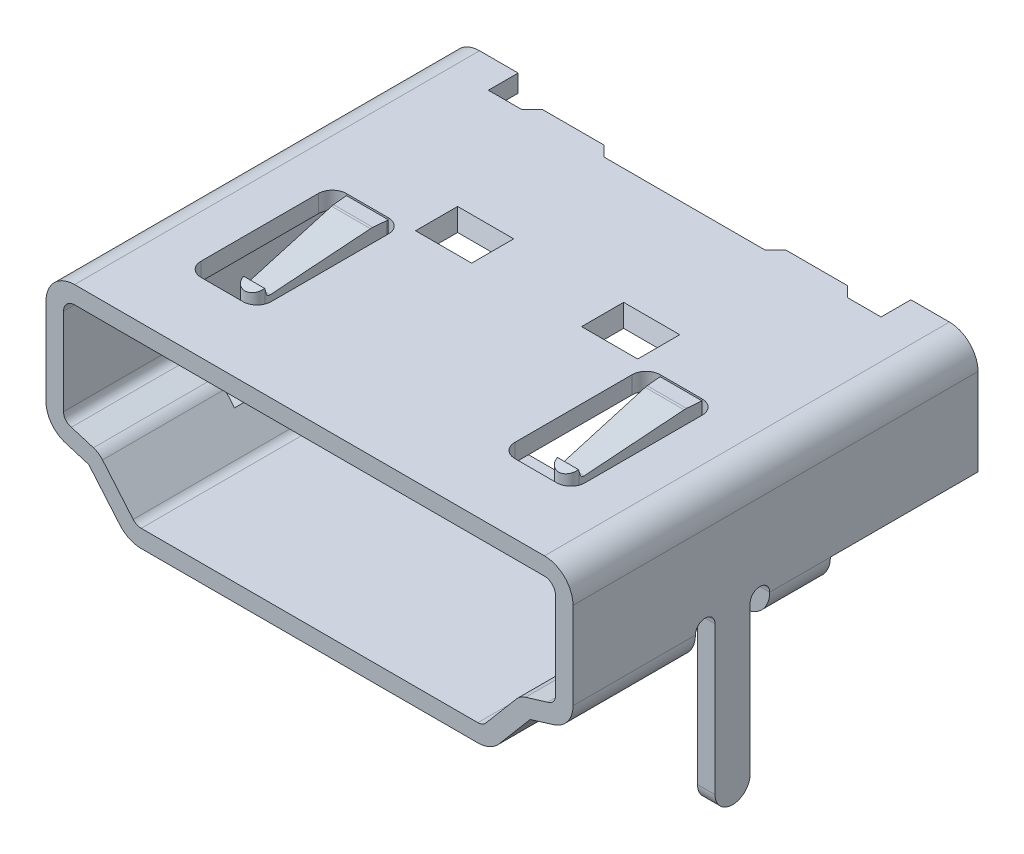
from build123d import *

# Parameters (mm, degrees)
BOSS_EXTRUDE1_DEPTH          = 11.55
CUT_EXTRUDE1_DEPTH           = 1.55
SKETCH4_W                    = 1.6
SKETCH4_H                    = 1.2
CUT_EXTRUDE2_DEPTH           = 1.55
CUT_EXTRUDE2_DRAFT           = -16
CUT_EXTRUDE2_PROFILE_2_DEPTH = 1.55
CUT_EXTRUDE2_PROFILE_2_DRAFT = -16
SKETCH5_W                    = 8.280650406
SKETCH5_H                    = 2.274542755
CUT_EXTRUDE3_DEPTH           = 20.322884811
CUT_EXTRUDE4_DEPTH           = 20.322884811
SKETCH7_W                    = 1
SKETCH7_H                    = 0.960522576
CUT_EXTRUDE5_DEPTH           = 20.322884811
SKETCH8_W                    = 0.5
SKETCH8_H                    = 1
BOSS_EXTRUDE2_DEPTH          = 4.72
FILLET1_RADIUS               = 0.5
FILLET1_LENGTH               = 0.5
FILLET1_OF_MIRROR1_2_RADIUS  = 0.5
FILLET1_OF_MIRROR1_2_LENGTH  = 0.5
CUT_EXTRUDE6_DEPTH           = 0.72
THICKEN1_START               = -5.069732995
THICKEN1_DEPTH               = 1.19
CUT_EXTRUDE7_DEPTH           = 1.19


# Read off the part's stored shape, not the designer's step: Thicken1
with BuildPart() as part:
    # Sketch2 → Boss-Extrude1 (new body)
    # profile 1 of 2: a face of its own
    with BuildSketch(Plane.XY):
        with BuildLine():
            Line((-6.7, 3.75320256), (6.7, 3.75320256))
            ThreePointArc((6.7, 3.75320256), (7.276103226, 3.514572791), (7.514732995, 2.938469565))
            Line((7.514732995, 2.938469565), (7.514732995, 0.458469565))
            ThreePointArc((7.514732995, 0.458469565), (7.348259409, -0.022963248), (6.919955693, -0.298729334))
            Line((6.919955693, -0.298729334), (6.308219645, -0.486088329))
            ThreePointArc((6.308219645, -0.486088329), (6.294961075, -0.49232974), (6.283997368, -0.502053011))
            Line((6.283997368, -0.502053011), (5.410870468, -1.533379231))
            ThreePointArc((5.410870468, -1.533379231), (5.13717933, -1.74196217), (4.801141776, -1.81607319))
            Line((4.801141776, -1.81607319), (-4.801141776, -1.81607319))
            ThreePointArc((-4.801141776, -1.81607319), (-5.13717933, -1.74196217), (-5.410870468, -1.533379231))
            Line((-5.410870468, -1.533379231), (-6.283997368, -0.502053011))
            ThreePointArc((-6.283997368, -0.502053011), (-6.294961075, -0.49232974), (-6.308219645, -0.486088329))
            Line((-6.308219645, -0.486088329), (-6.919955693, -0.298729334))
            ThreePointArc((-6.919955693, -0.298729334), (-7.348259409, -0.022963248), (-7.514732995, 0.458469565))
            Line((-7.514732995, 0.458469565), (-7.514732995, 2.938469565))
            ThreePointArc((-7.514732995, 2.938469565), (-7.276103226, 3.514572791), (-6.7, 3.75320256))
        make_face()
        with BuildLine():
            ThreePointArc((-6.7, 3.50320256), (-7.099326531, 3.337796096), (-7.264732995, 2.938469565))
            Line((-7.264732995, 2.938469565), (-7.264732995, 0.458469565))
            ThreePointArc((-7.264732995, 0.458469565), (-7.149624286, 0.12889174), (-6.854357158, -0.057357774))
            Line((-6.854357158, -0.057357774), (-6.235007902, -0.247048498))
            ThreePointArc((-6.235007902, -0.247048498), (-6.157382735, -0.283590188), (-6.093193339, -0.340517187))
            Line((-6.093193339, -0.340517187), (-5.220066439, -1.371843407))
            ThreePointArc((-5.220066439, -1.371843407), (-5.0320222, -1.51515393), (-4.801141776, -1.56607319))
            Line((-4.801141776, -1.56607319), (4.801141776, -1.56607319))
            ThreePointArc((4.801141776, -1.56607319), (5.0320222, -1.51515393), (5.220066439, -1.371843407))
            Line((5.220066439, -1.371843407), (6.093193339, -0.340517187))
            ThreePointArc((6.093193339, -0.340517187), (6.157382735, -0.283590188), (6.235007902, -0.247048498))
            Line((6.235007902, -0.247048498), (6.854357158, -0.057357774))
            ThreePointArc((6.854357158, -0.057357774), (7.149624286, 0.12889174), (7.264732995, 0.458469565))
            Line((7.264732995, 0.458469565), (7.264732995, 2.938469565))
            ThreePointArc((7.264732995, 2.938469565), (7.099326531, 3.337796096), (6.7, 3.50320256))
            Line((6.7, 3.50320256), (-6.7, 3.50320256))
        make_face(mode=Mode.SUBTRACT)
    # profile 2 of 2: a face of its own
    with BuildSketch(Plane.XY):
        with BuildLine():
            Line((-6.7, 3.50320256), (6.7, 3.50320256))
            ThreePointArc((6.7, 3.50320256), (7.099326531, 3.337796096), (7.264732995, 2.938469565))
            Line((7.264732995, 2.938469565), (7.264732995, 0.458469565))
            ThreePointArc((7.264732995, 0.458469565), (7.149624286, 0.12889174), (6.854357158, -0.057357774))
            Line((6.854357158, -0.057357774), (6.235007902, -0.247048498))
            ThreePointArc((6.235007902, -0.247048498), (6.157382735, -0.283590188), (6.093193339, -0.340517187))
            Line((6.093193339, -0.340517187), (5.220066439, -1.371843407))
            ThreePointArc((5.220066439, -1.371843407), (5.0320222, -1.51515393), (4.801141776, -1.56607319))
            Line((4.801141776, -1.56607319), (-4.801141776, -1.56607319))
            ThreePointArc((-4.801141776, -1.56607319), (-5.0320222, -1.51515393), (-5.220066439, -1.371843407))
            Line((-5.220066439, -1.371843407), (-6.093193339, -0.340517187))
            ThreePointArc((-6.093193339, -0.340517187), (-6.157382735, -0.283590188), (-6.235007902, -0.247048498))
            Line((-6.235007902, -0.247048498), (-6.854357158, -0.057357774))
            ThreePointArc((-6.854357158, -0.057357774), (-7.149624286, 0.12889174), (-7.264732995, 0.458469565))
            Line((-7.264732995, 0.458469565), (-7.264732995, 2.938469565))
            ThreePointArc((-7.264732995, 2.938469565), (-7.099326531, 3.337796096), (-6.7, 3.50320256))
        make_face()
        with BuildLine():
            ThreePointArc((-6.7, 3.25320256), (-6.922549835, 3.1610194), (-7.014732995, 2.938469565))
            Line((-7.014732995, 2.938469565), (-7.014732995, 0.458469565))
            ThreePointArc((-7.014732995, 0.458469565), (-6.951656403, 0.281649019), (-6.790909083, 0.184672417))
            Line((-6.790909083, 0.184672417), (-6.161796159, -0.008008667))
            ThreePointArc((-6.161796159, -0.008008667), (-6.019804394, -0.074850637), (-5.902389309, -0.178981364))
            Line((-5.902389309, -0.178981364), (-5.029262409, -1.210307583))
            ThreePointArc((-5.029262409, -1.210307583), (-4.92686507, -1.288345689), (-4.801141776, -1.31607319))
            Line((-4.801141776, -1.31607319), (4.801141776, -1.31607319))
            ThreePointArc((4.801141776, -1.31607319), (4.92686507, -1.288345689), (5.029262409, -1.210307583))
            Line((5.029262409, -1.210307583), (5.902389309, -0.178981364))
            ThreePointArc((5.902389309, -0.178981364), (6.019804394, -0.074850637), (6.161796159, -0.008008667))
            Line((6.161796159, -0.008008667), (6.790909083, 0.184672417))
            ThreePointArc((6.790909083, 0.184672417), (6.951656403, 0.281649019), (7.014732995, 0.458469565))
            Line((7.014732995, 0.458469565), (7.014732995, 2.938469565))
            ThreePointArc((7.014732995, 2.938469565), (6.922549835, 3.1610194), (6.7, 3.25320256))
            Line((6.7, 3.25320256), (-6.7, 3.25320256))
        make_face(mode=Mode.SUBTRACT)
    extrude(amount=-BOSS_EXTRUDE1_DEPTH)

    # Sketch3 → Cut-Extrude1 (cut)
    with BuildSketch(Plane(origin=(0, 3.75320256, 0), x_dir=(1, 0, 0), z_dir=(0, 1, 0))):
        Polygon((-5.6, 11.55), (-5.6, 10.7), (-4.65, 10.7), (-4.354264255, 10.995735745), (-2.594264255, 10.995735745), (-2.298528509, 10.7), (2.298528509, 10.7), (2.594264255, 10.995735745), (4.354264255, 10.995735745), (4.65, 10.7), (5.6, 10.7), (5.6, 11.55), align=None)
    extrude(amount=-CUT_EXTRUDE1_DEPTH, mode=Mode.SUBTRACT)


with BuildPart() as cut_extrude2_tool:
    # Sketch4 → Cut-Extrude2 (with draft: the straight prism first)
    with BuildSketch(Plane(origin=(0, 3.75320256, 0), x_dir=(1, 0, 0), z_dir=(0, 1, 0))):
        with Locations((-2.367658428, 6.791688741)):
            Rectangle(SKETCH4_W, SKETCH4_H)
    extrude(amount=-CUT_EXTRUDE2_DEPTH)
    # Cut-Extrude2: the draft: its side faces are tilted about the plane it starts from
    cut_extrude2_sides = [cut_extrude2_tool.faces().sort_by_distance(p)[0] for p in [
        (-3.167658428, 2.97820256, -6.791688741),
        (-2.367658428, 2.97820256, -6.191688741),
        (-1.567658428, 2.97820256, -6.791688741),
        (-2.367658428, 2.97820256, -7.391688741),
    ]]
    draft(cut_extrude2_sides, Plane(origin=(0, 3.75320256, 0), x_dir=(1, 0, 0), z_dir=(0, 1, 0)), CUT_EXTRUDE2_DRAFT)


with BuildPart() as part_1:
    add(part.part)

    # Cut-Extrude2: cut by cut_extrude2_tool
    add(cut_extrude2_tool.part, mode=Mode.SUBTRACT)


with BuildPart() as cut_extrude2_profile_2_tool:
    # Sketch4 → Cut-Extrude2 profile 2 (with draft: the straight prism first)
    with BuildSketch(Plane(origin=(0, 3.75320256, 0), x_dir=(1, 0, 0), z_dir=(0, 1, 0))):
        with Locations((2.367658428, 6.791688741)):
            Rectangle(SKETCH4_W, SKETCH4_H)
    extrude(amount=-CUT_EXTRUDE2_PROFILE_2_DEPTH)
    # Cut-Extrude2 profile 2: the draft: its side faces are tilted about the plane it starts from
    cut_extrude2_profile_2_sides = [cut_extrude2_profile_2_tool.faces().sort_by_distance(p)[0] for p in [
        (1.567658428, 2.97820256, -6.791688741),
        (2.367658428, 2.97820256, -6.191688741),
        (3.167658428, 2.97820256, -6.791688741),
        (2.367658428, 2.97820256, -7.391688741),
    ]]
    draft(cut_extrude2_profile_2_sides, Plane(origin=(0, 3.75320256, 0), x_dir=(1, 0, 0), z_dir=(0, 1, 0)), CUT_EXTRUDE2_PROFILE_2_DRAFT)


with BuildPart() as part_2:
    add(part_1.part)

    # Cut-Extrude2 profile 2: cut by cut_extrude2_profile_2_tool
    add(cut_extrude2_profile_2_tool.part, mode=Mode.SUBTRACT)

    # Sketch5 → Cut-Extrude3 (cut, through all)
    with BuildSketch(Plane(origin=(7.514732995, 0, 0), x_dir=(0, 0, -1), z_dir=(1, 0, 0))):
        with Locations((11.480325203, -0.678801812)):
            Rectangle(SKETCH5_W, SKETCH5_H)
    extrude(amount=-CUT_EXTRUDE3_DEPTH, mode=Mode.SUBTRACT)

    # Sketch6 → Cut-Extrude4 (cut, through all)
    with BuildSketch(Plane(origin=(7.514732995, 0, 0), x_dir=(0, 0, -1), z_dir=(1, 0, 0))):
        with BuildLine():
            Line((3.49, -0.502053011), (3.49, 0.458469565))
            ThreePointArc((3.49, 0.458469565), (3.77, 0.738469565), (4.05, 0.458469565))
            Line((4.05, 0.458469565), (4.05, -0.502053011))
            Line((4.05, -0.502053011), (3.49, -0.502053011))
        make_face()
        with BuildLine():
            Line((5.05, -0.502053011), (5.05, 0.458469565))
            ThreePointArc((5.05, 0.458469565), (5.33, 0.738469565), (5.61, 0.458469565))
            Line((5.61, 0.458469565), (5.61, -0.502053011))
            Line((5.61, -0.502053011), (5.05, -0.502053011))
        make_face()
    extrude(amount=-CUT_EXTRUDE4_DEPTH, mode=Mode.SUBTRACT)

    # Sketch7 → Cut-Extrude5 (cut, through all)
    with BuildSketch(Plane(origin=(7.514732995, 0, 0), x_dir=(0, 0, -1), z_dir=(1, 0, 0))):
        with Locations((4.55, -0.021791723)):
            Rectangle(SKETCH7_W, SKETCH7_H)
    extrude(amount=-CUT_EXTRUDE5_DEPTH, mode=Mode.SUBTRACT)

    # Sketch8 → Boss-Extrude2 (add)
    with BuildSketch(Plane.XZ.offset(-0.458469565)):
        with Locations((7.264732995, -4.55)):
            Rectangle(SKETCH8_W, SKETCH8_H)
    boss_extrude2 = extrude(amount=BOSS_EXTRUDE2_DEPTH)

    # Fillet1: full round fillet: the end face becomes a half cylinder, R = half its width
    fillet1_face = Plane((7.264732995, -4.261530435, -4.55), x_dir=(1, 0, 0), z_dir=(0, -1, 0))  # on the end face: x along it, z out of the body
    fillet1_slab = fillet1_face.offset(-FILLET1_RADIUS / 2) * Box(FILLET1_LENGTH, 2 * FILLET1_RADIUS, FILLET1_RADIUS, mode=Mode.PRIVATE)  # the body's end, R deep
    fillet1_round = Plane((7.264732995, -3.761530435, -4.55), x_dir=(0, -1, 0), z_dir=(1, 0, 0)) * Cylinder(FILLET1_RADIUS, FILLET1_LENGTH, mode=Mode.PRIVATE)  # its axis R under the face
    add(fillet1_slab - fillet1_round, mode=Mode.SUBTRACT)

    # Mirror1: Boss-Extrude2 across plane
    add(boss_extrude2.mirror(Plane(origin=(0, 0, 0), x_dir=(0, 0, 1), z_dir=(1, 0, 0))))

    # Fillet1 of Mirror1 2: full round fillet: the end face becomes a half cylinder, R = half its width
    fillet1_of_mirror1_2_face = Plane((-7.264732995, -4.261530435, -4.55), x_dir=(-1, 0, 0), z_dir=(0, -1, 0))  # on the end face: x along it, z out of the body
    fillet1_of_mirror1_2_slab = fillet1_of_mirror1_2_face.offset(-FILLET1_OF_MIRROR1_2_RADIUS / 2) * Box(FILLET1_OF_MIRROR1_2_LENGTH, 2 * FILLET1_OF_MIRROR1_2_RADIUS, FILLET1_OF_MIRROR1_2_RADIUS, mode=Mode.PRIVATE)  # the body's end, R deep
    fillet1_of_mirror1_2_round = Plane((-7.264732995, -3.761530435, -4.55), x_dir=(0, -1, 0), z_dir=(-1, 0, 0)) * Cylinder(FILLET1_OF_MIRROR1_2_RADIUS, FILLET1_OF_MIRROR1_2_LENGTH, mode=Mode.PRIVATE)  # its axis R under the face
    add(fillet1_of_mirror1_2_slab - fillet1_of_mirror1_2_round, mode=Mode.SUBTRACT)

    # Sketch9 → Cut-Extrude6 (cut)
    with BuildSketch(Plane(origin=(0, 3.75320256, 0), x_dir=(1, 0, 0), z_dir=(0, 1, 0))):
        with BuildLine():
            Line((-5.074869856, 6.12532212), (-3.874869856, 6.12532212))
            ThreePointArc((-3.874869856, 6.12532212), (-3.592027144, 6.008164832), (-3.474869856, 5.72532212))
            Line((-3.474869856, 5.72532212), (-3.474869856, 2.379962617))
            ThreePointArc((-3.474869856, 2.379962617), (-3.592027144, 2.097119904), (-3.874869856, 1.979962617))
            Line((-3.874869856, 1.979962617), (-5.074869856, 1.979962617))
            ThreePointArc((-5.074869856, 1.979962617), (-5.357712569, 2.097119904), (-5.474869856, 2.379962617))
            Line((-5.474869856, 2.379962617), (-5.474869856, 5.72532212))
            ThreePointArc((-5.474869856, 5.72532212), (-5.357712569, 6.008164832), (-5.074869856, 6.12532212))
        make_face()
        with BuildLine():
            Line((3.474869856, 5.72532212), (3.474869856, 2.379962617))
            ThreePointArc((3.474869856, 2.379962617), (3.592027144, 2.097119904), (3.874869856, 1.979962617))
            Line((3.874869856, 1.979962617), (5.074869856, 1.979962617))
            ThreePointArc((5.074869856, 1.979962617), (5.357712569, 2.097119904), (5.474869856, 2.379962617))
            Line((5.474869856, 2.379962617), (5.474869856, 5.72532212))
            ThreePointArc((5.474869856, 5.72532212), (5.357712569, 6.008164832), (5.074869856, 6.12532212))
            Line((5.074869856, 6.12532212), (3.874869856, 6.12532212))
            ThreePointArc((3.874869856, 6.12532212), (3.592027144, 6.008164832), (3.474869856, 5.72532212))
        make_face()
    extrude(amount=-CUT_EXTRUDE6_DEPTH, mode=Mode.SUBTRACT)

    # Thicken1 outline → Thicken1 (add)
    with BuildSketch(Plane.YZ.offset(THICKEN1_START)):
        with BuildLine():
            add(Edge.make_bspline(
                [(2.850212091, -3.078275444), (2.850212091, -3.076316593), (2.850212091, -3.074357742), (2.850212091, -3.072398891), (2.850212091, -3.070440041), (2.850212091, -3.06848119), (2.850212091, -3.066522339), (2.850212091, -3.064563488), (2.850212091, -3.060645786), (2.850212043, -3.058690244), (2.850212082, -3.056702369), (2.850212563, -3.054690629), (2.850213862, -3.052666713), (2.850216294, -3.050628014), (2.850220143, -3.04856348), (2.850237151, -3.042321583), (2.850255329, -3.038086286), (2.85028355, -3.03377786), (2.850325016, -3.029397209), (2.85038293, -3.024945239), (2.850460495, -3.020422854), (2.850560913, -3.015830958), (2.850940338, -3.00184945), (2.851298462, -2.992255064), (2.851791373, -2.982391453), (2.852450166, -2.972265477), (2.853307421, -2.961886696), (2.854397204, -2.951267371), (2.855755066, -2.940422465), (2.860743994, -2.90726399), (2.86529137, -2.884334598), (2.871323515, -2.860736691), (2.879145557, -2.836729782), (2.888955468, -2.812704996), (2.90076942, -2.789143902), (2.914421458, -2.766508864), (2.96006948, -2.702177025), (2.996757588, -2.66405391), (3.037710526, -2.633115743), (3.078954455, -2.609031109), (3.120693409, -2.588847332), (3.162137407, -2.572513504), (3.202624968, -2.558912799), (3.240920753, -2.547649333)],
                knots=[-0.034948444, -0.034948444, -0.034948444, -0.034948444, -0.034948444, -0.034948444, -0.034948444, -0.034948444, -0.034948444, -0.002606305, -0.002606305, -0.002606305, -0.002606305, -0.002606305, -0.002606305, -0.002606305, 0.029735834, 0.029735834, 0.029735834, 0.029735834, 0.029735834, 0.029735834, 0.029735834, 0.094420112, 0.094420112, 0.094420112, 0.094420112, 0.094420112, 0.094420112, 0.094420112, 0.223788667, 0.223788667, 0.223788667, 0.223788667, 0.223788667, 0.223788667, 0.223788667, 0.482525778, 0.482525778, 0.482525778, 0.482525778, 0.482525778, 0.482525778, 0.482525778, 1, 1, 1, 1, 1, 1, 1, 1, 1], degree=8))
            Line((2.850212091, -3.078275444), (3.301485098, -5.724120022))
            ThreePointArc((3.301485098, -5.724120022), (3.302411703, -5.729960798), (3.30320256, -5.735821499))
            Line((3.30320256, -5.735821499), (3.30320256, -6.12532212))
            Line((3.30320256, -6.12532212), (3.70320256, -6.12532212))
            Line((3.70320256, -6.12532212), (3.70320256, -5.716981074))
            ThreePointArc((3.70320256, -5.716981074), (3.700192078, -5.686838583), (3.69579095, -5.65686755))
            Line((3.69579095, -5.65686755), (3.250234497, -3.044540296))
            add(Edge.make_bspline(
                [(3.250234497, -3.044540296), (3.250314904, -3.025131196), (3.250606814, -3.009052768), (3.251381636, -2.996292271), (3.25262308, -2.986873686), (3.254156873, -2.980836564), (3.255278843, -2.977849159), (3.25576303, -2.9767608), (3.255885732, -2.976501178)],
                knots=[0.036681305, 0.036681305, 0.036681305, 0.036681305, 0.036681305, 0.036681305, 0.036681305, 0.036681305, 0.036681305, 0.396456202, 0.396456202, 0.396456202, 0.396456202, 0.396456202, 0.396456202, 0.396456202, 0.396456202, 0.396456202], degree=8))
            add(Edge.make_bspline(
                [(3.255885732, -2.976501178), (3.256122404, -2.976187515), (3.257424593, -2.974534073), (3.261846766, -2.969674907), (3.272239994, -2.962060442), (3.2875759, -2.954266767), (3.307108818, -2.946143972), (3.329591026, -2.93851208), (3.353787282, -2.931395534)],
                knots=[0.49422604, 0.49422604, 0.49422604, 0.49422604, 0.49422604, 0.49422604, 0.49422604, 0.49422604, 0.49422604, 1, 1, 1, 1, 1, 1, 1, 1, 1], degree=8))
            Line((3.353787282, -2.931395534), (3.473872704, -2.896076292))
            Line((3.473872704, -2.896076292), (3.361006175, -2.512330091))
            Line((3.361006175, -2.512330091), (3.240920753, -2.547649333))
        make_face()
    extrude(amount=THICKEN1_DEPTH)

    # Sketch11 → Cut-Extrude7 (cut)
    with BuildSketch(Plane(origin=(0, 3.75320256, 0), x_dir=(1, 0, 0), z_dir=(0, 1, 0))):
        with BuildLine():
            Line((-4.774902915, 2.903923269), (-5.069732995, 6.12532212))
            Line((-5.069732995, 6.12532212), (-5.069732995, 2.512330091))
            Line((-5.069732995, 2.512330091), (-3.879732995, 2.512330091))
            Line((-3.879732995, 2.512330091), (-3.879732995, 6.073048296))
            Line((-3.879732995, 6.073048296), (-4.174563076, 2.903923269))
            ThreePointArc((-4.174563076, 2.903923269), (-4.474732995, 2.629971073), (-4.774902915, 2.903923269))
        make_face()
    extrude(amount=-CUT_EXTRUDE7_DEPTH, mode=Mode.SUBTRACT)

    # Mirror2: part across plane


with BuildPart() as part_3:
    add(part_2.part)
    add(part_2.part.mirror(Plane(origin=(0, 0, 0), x_dir=(0, 0, 1), z_dir=(1, 0, 0))))


solid = part_3.part
